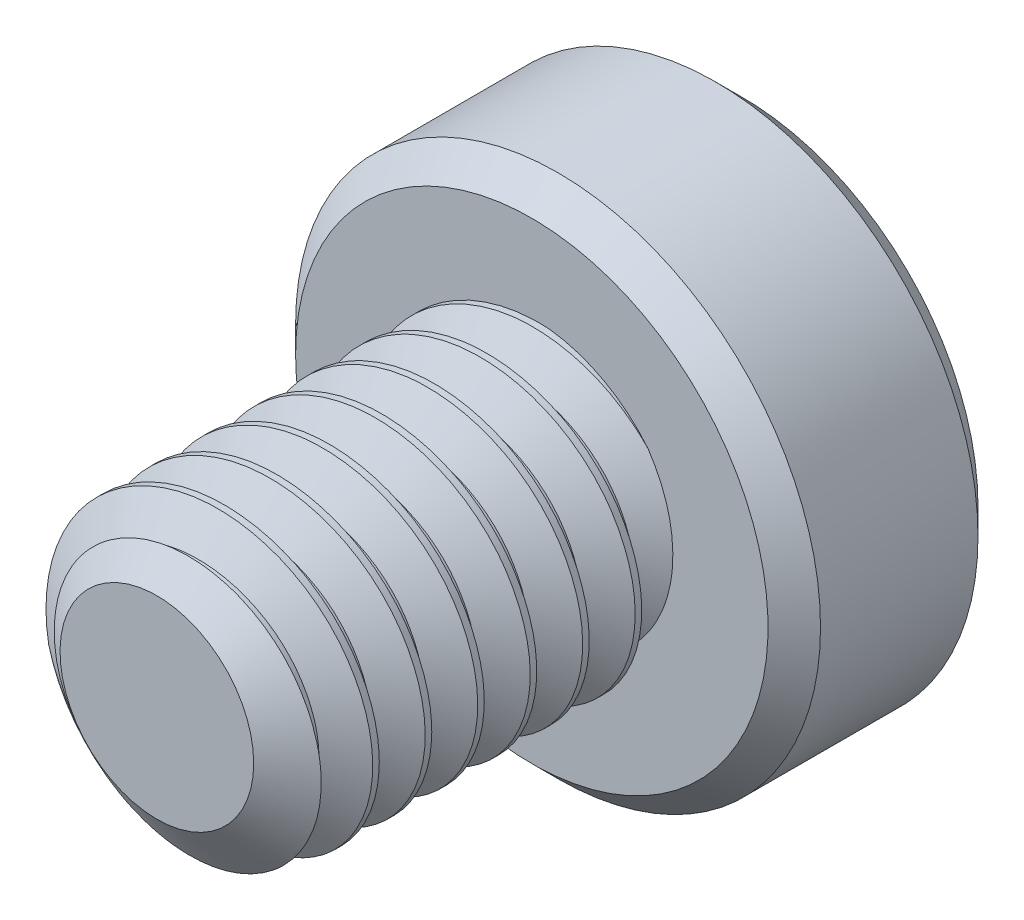
from build123d import *

# Parameters (mm, degrees)
SKETCH1_R          = 2
EXTRUDE1_DEPTH     = 5
CUT_SWEEP1_PITCH   = 0.7
SKETCH6_R          = 3.5
EXTRUDE2_DEPTH     = 2.8
CUT_EXTRUDE1_DEPTH = 1.875
CHAMFER1_SIZE      = 0.35


with BuildPart() as part:
    # Sketch1 → Extrude1 (new body)
    with BuildSketch(Plane.XY):
        Circle(SKETCH1_R)
    extrude(amount=-EXTRUDE1_DEPTH)

    # Cut-Sweep1: the profile of Sketch3 profile screwed along a right-hand helix of 8.142857 turns, 6 arcs to a turn; built about Z, then put on its axis
    cut_sweep1_z = Axis((0, 0, 0), (0, 0, 1))
    cut_sweep1_corners = [(2.0003, 0, -0.612673205), (1.545336663, 0, -0.35), (1.545336663, 0, -0.2625), (2.0003, 0, 0.000173205)]
    with BuildLine(mode=Mode.PRIVATE) as cut_sweep1_profile:
        Line(cut_sweep1_corners[0], cut_sweep1_corners[1])
        Line(cut_sweep1_corners[1], cut_sweep1_corners[2])
        Line(cut_sweep1_corners[2], cut_sweep1_corners[3])
        Line(cut_sweep1_corners[3], cut_sweep1_corners[0])
    cut_sweep1_cap = Face(cut_sweep1_profile.wire())
    cut_sweep1_turn_angles = [0, 30, 60, 90, 120, 150, 180, 210, 240, 270, 300, 330, 360]
    cut_sweep1_turn_weights = [1, 0.8660254037844387, 1, 0.8660254037844387, 1, 0.8660254037844387, 1, 0.8660254037844387, 1, 0.8660254037844387, 1, 0.8660254037844387, 1]
    cut_sweep1_turn_rails = [Edge.make_bspline([Vector(p[0], p[1], 0).rotate(cut_sweep1_z, cut_sweep1_turn_angles[k]) / cut_sweep1_turn_weights[k] + Vector(0, 0, p[2] + CUT_SWEEP1_PITCH * cut_sweep1_turn_angles[k] / 360) for k in range(13)], [0, 0, 0, 1, 1, 2, 2, 3, 3, 4, 4, 5, 5, 6, 6, 6], 2, cut_sweep1_turn_weights) for p in cut_sweep1_corners]
    cut_sweep1_turn_sides = [Face.make_surface_from_curves(cut_sweep1_turn_rails[p[0]], cut_sweep1_turn_rails[p[1]]) for p in [(0, 1), (1, 2), (2, 3), (3, 0)]]
    cut_sweep1_last_angles = [2880, 2905.714285714, 2931.428571429]
    cut_sweep1_last_weights = [1, 0.9009688679023722, 1]
    cut_sweep1_last_rails = [Edge.make_bspline([Vector(p[0], p[1], 0).rotate(cut_sweep1_z, cut_sweep1_last_angles[k]) / cut_sweep1_last_weights[k] + Vector(0, 0, p[2] + CUT_SWEEP1_PITCH * cut_sweep1_last_angles[k] / 360) for k in range(3)], [0, 0, 0, 1, 1, 1], 2, cut_sweep1_last_weights) for p in cut_sweep1_corners]
    cut_sweep1_last_sides = [Face.make_surface_from_curves(cut_sweep1_last_rails[p[0]], cut_sweep1_last_rails[p[1]]) for p in [(0, 1), (1, 2), (2, 3), (3, 0)]]
    cut_sweep1 = Plane(origin=(0, 0, 0), x_dir=(0, 1, 0), z_dir=(0, 0, -1)) * Solid(Shell([*[p.moved(Location((0, 0, CUT_SWEEP1_PITCH * i))) for i in range(8) for p in cut_sweep1_turn_sides], *cut_sweep1_last_sides, cut_sweep1_cap, cut_sweep1_cap.rotate(cut_sweep1_z, 2931.428571429).moved(Location((0, 0, CUT_SWEEP1_PITCH * 2931.428571429 / 360)))]))
    add(cut_sweep1, mode=Mode.SUBTRACT)

    # Sketch4 → Cut-Revolve1 (revolve, cut)
    with BuildSketch(Plane(origin=(0, 0, 0), x_dir=(0, 0, -1), z_dir=(1, 0, 0)), mode=Mode.PRIVATE) as cut_revolve1_sk:
        Polygon((0.496211411, 2), (0, 1.291336663), (0, 2), align=None)
    revolve(cut_revolve1_sk.sketch.rotate(Axis((0, 0, 0), (0, 0, -1)), 271.401126896), axis=Axis((0, 0, 0), (0, 0, -1)), mode=Mode.SUBTRACT)

    # Sketch6 → Extrude2 (add)
    with BuildSketch(Plane(origin=(0, 0, -5), x_dir=(-1, 0, 0), z_dir=(0, 0, -1))):
        Circle(SKETCH6_R)
    extrude(amount=EXTRUDE2_DEPTH)

    # Sketch7 → Cut-Extrude1 (cut)
    with BuildSketch(Plane(origin=(0, 0, -7.8), x_dir=(-1, 0, 0), z_dir=(0, 0, -1))):
        Polygon((0, 1.443375673), (-1.25, 0.721687836), (-1.25, -0.721687836), (0, -1.443375673), (1.25, -0.721687836), (1.25, 0.721687836), align=None)
    extrude(amount=-CUT_EXTRUDE1_DEPTH, mode=Mode.SUBTRACT)

    # Cut-Extrude2 cone 1 section (through the dimple's axis) → Cut-Extrude2 (revolve, cut)
    with BuildSketch(Plane(origin=(0, 0, -7.8), x_dir=(0, 1, 0), z_dir=(1, 0, 0))):
        Polygon((0, 0), (1.443375673, 0), (0, 1.443375673), align=None)
    revolve(axis=Axis((0, 0, -7.8), (0, 0, 1)), mode=Mode.SUBTRACT)

    # Chamfer1
    chamfer1_edges = [part.edges().sort_by_distance(p)[0] for p in [
        (3.5, 0, -5),
        (3.5, 0, -7.8),
    ]]
    chamfer(chamfer1_edges, length=CHAMFER1_SIZE)


solid = part.part
